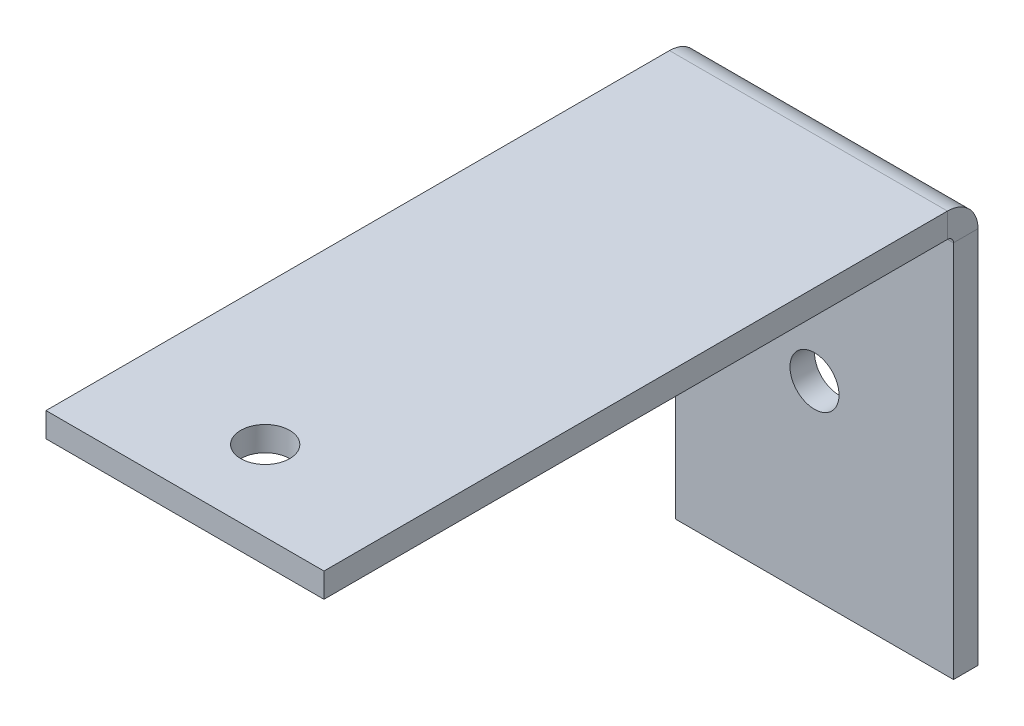
from build123d import *

# Parameters (mm, degrees)
SKETCH1_W                    = 34
SKETCH1_H                    = 3
BASE_FLANGE1_DEPTH           = 50
EDGE_FLANGE1_STRIP_W         = 13.4732
EDGE_FLANGE1_STRIP_H         = 3
EDGE_FLANGE1_STRIP_CUT_DEPTH = 34
EDGE_FLANGE1_DEPTH           = 34
SKETCH9_R                    = 3
CUT_EXTRUDE1_DEPTH           = 10
SKETCH10_R                   = 3
CUT_EXTRUDE2_DEPTH           = 10


# Sheet-metal steps are written as plain solids
with BuildPart() as part:
    # Sketch1 → Base-Flange1 (new body)
    with BuildSketch(Plane(origin=(0, 0, 0), x_dir=(1, 0, 0), z_dir=(0, 1, 0))):
        with Locations((17, -1.5)):
            Rectangle(SKETCH1_W, SKETCH1_H)
    extrude(amount=BASE_FLANGE1_DEPTH)

    # Edge-Flange1 strip (across the edge) → Edge-Flange1 strip cut (cut)
    with BuildSketch(Plane(origin=(34, 50, 3), x_dir=(0, -1, 0), z_dir=(-1, 0, 0))):
        with Locations((-3, -1.5)):
            Rectangle(EDGE_FLANGE1_STRIP_W, EDGE_FLANGE1_STRIP_H)
    extrude(amount=EDGE_FLANGE1_STRIP_CUT_DEPTH, mode=Mode.SUBTRACT)

    # Edge-Flange1 section (across the edge) → Edge-Flange1 (add)
    with BuildSketch(Plane(origin=(34, 50, 3), x_dir=(0, -1, 0), z_dir=(-1, 0, 0))):
        with BuildLine():
            Line((0, 0.7366), (0, 77))
            Line((0, 77), (3, 77))
            Line((3, 77), (3, 0.7366))
            ThreePointArc((3, 0.7366), (3.215745145, 0.215745145), (3.7366, 0))
            Line((3.7366, 0), (3.7366, -3))
            ThreePointArc((3.7366, -3), (1.094424801, -1.905575199), (0, 0.7366))
        make_face()
    extrude(amount=EDGE_FLANGE1_DEPTH)

    # Sketch9 → Cut-Extrude1 (cut)
    with BuildSketch(Plane(origin=(0, 50, 0), x_dir=(1, 0, 0), z_dir=(0, 1, 0))):
        with Locations(Location((17, -70.19, 0), (0, 0, 270))):
            Circle(SKETCH9_R)
    extrude(amount=-CUT_EXTRUDE1_DEPTH, mode=Mode.SUBTRACT)

    # Sketch10 → Cut-Extrude2 (cut)
    with BuildSketch(Plane.XY.offset(3)):
        with Locations((17, 23.1317)):
            Circle(SKETCH10_R)
    extrude(amount=-CUT_EXTRUDE2_DEPTH, mode=Mode.SUBTRACT)


solid = part.part
